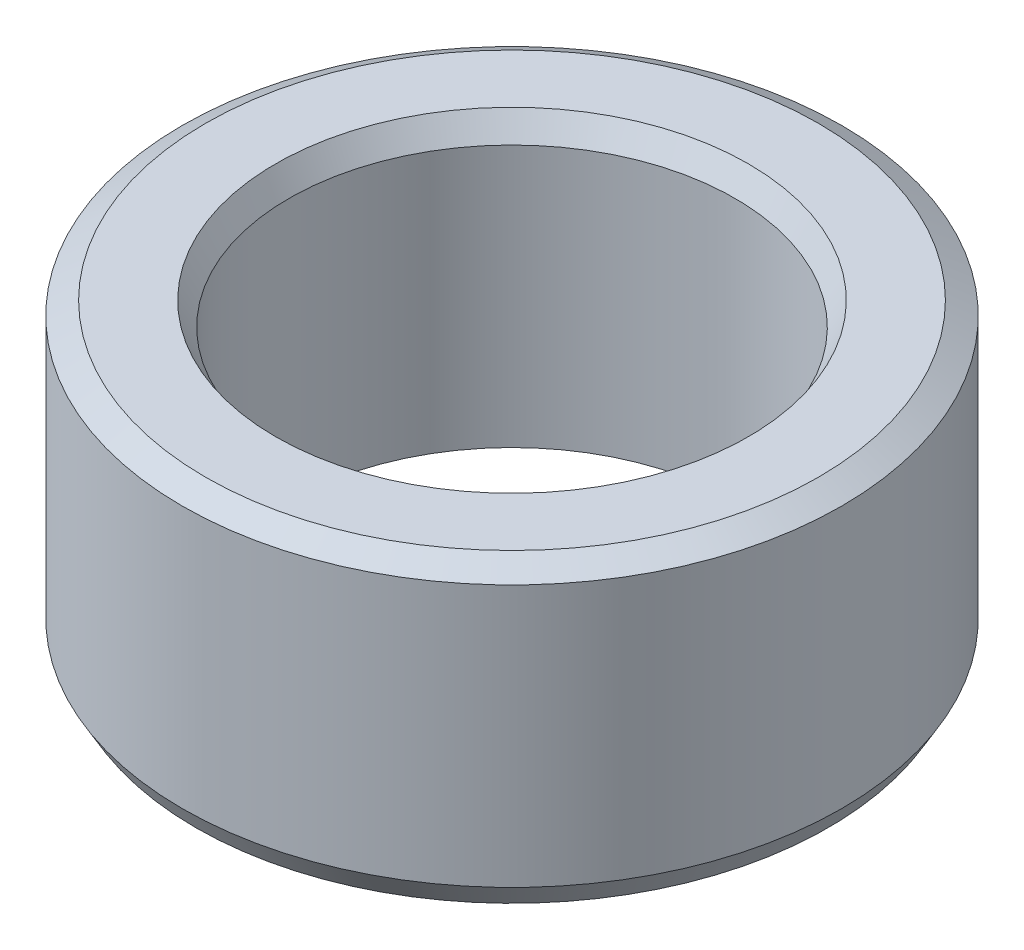
from build123d import *
from OCP.BRepFilletAPI import BRepFilletAPI_MakeChamfer

# Parameters (mm, degrees)
SKETCH1_R           = 40
BOSS_EXTRUDE1_DEPTH = 36.228711317
SKETCH2_R           = 27.0538034
CUT_EXTRUDE1_DEPTH  = 68.175289532
CHAMFER1_SIZE       = 1.626429454
CHAMFER1_SIZE2      = 2.817058449


with BuildPart() as part:
    # Sketch1 → Boss-Extrude1 (new body)
    with BuildSketch(Plane(origin=(0, 0, 0), x_dir=(1, 0, 0), z_dir=(0, 1, 0))):
        Circle(SKETCH1_R)
    extrude(amount=BOSS_EXTRUDE1_DEPTH)

    # Sketch2 → Cut-Extrude1 (cut, through all)
    with BuildSketch(Plane(origin=(0, 0, 0), x_dir=(1, 0, 0), z_dir=(0, 1, 0))):
        Circle(SKETCH2_R)
    extrude(amount=CUT_EXTRUDE1_DEPTH, mode=Mode.SUBTRACT)

    # Chamfer1: one chamfer whose edges measure the first distance from different faces: ONE call of the kernel's chamfer builder (chamfer() names one face for all edges)
    chamfer1_edges_1 = [part.edges().sort_by_distance(p)[0] for p in [
        (-27.0538034, 36.228711317, 0),
    ]]
    chamfer1_side_1 = [part.faces().sort_by_distance(p)[0] for p in [
        (-38.86862915, 36.228711317, 0),
    ]]
    chamfer1_edges_2 = [part.edges().sort_by_distance(p)[0] for p in [
        (-27.0538034, 0, 0),
    ]]
    chamfer1_side_2 = [part.faces().sort_by_distance(p)[0] for p in [
        (-27.0538034, 18.114355658, 0),
    ]]
    chamfer1_edges_3 = [part.edges().sort_by_distance(p)[0] for p in [
        (-40, 0, 0),
    ]]
    chamfer1_side_3 = [part.faces().sort_by_distance(p)[0] for p in [
        (-38.86862915, 0, 0),
    ]]
    chamfer1_edges_4 = [part.edges().sort_by_distance(p)[0] for p in [
        (-40, 36.228711317, 0),
    ]]
    chamfer1_side_4 = [part.faces().sort_by_distance(p)[0] for p in [
        (-40, 18.114355658, 0),
    ]]
    chamfer1 = BRepFilletAPI_MakeChamfer(part.part.solid().wrapped)
    for e in chamfer1_edges_1:
        chamfer1.Add(CHAMFER1_SIZE, CHAMFER1_SIZE2, e.wrapped, chamfer1_side_1[0].wrapped)  # the first distance lies on this face
    for e in chamfer1_edges_2:
        chamfer1.Add(CHAMFER1_SIZE, CHAMFER1_SIZE2, e.wrapped, chamfer1_side_2[0].wrapped)  # the first distance lies on this face
    for e in chamfer1_edges_3:
        chamfer1.Add(CHAMFER1_SIZE, CHAMFER1_SIZE2, e.wrapped, chamfer1_side_3[0].wrapped)  # the first distance lies on this face
    for e in chamfer1_edges_4:
        chamfer1.Add(CHAMFER1_SIZE, CHAMFER1_SIZE2, e.wrapped, chamfer1_side_4[0].wrapped)  # the first distance lies on this face
    add(Compound.cast(chamfer1.Shape()), mode=Mode.REPLACE)


solid = part.part
